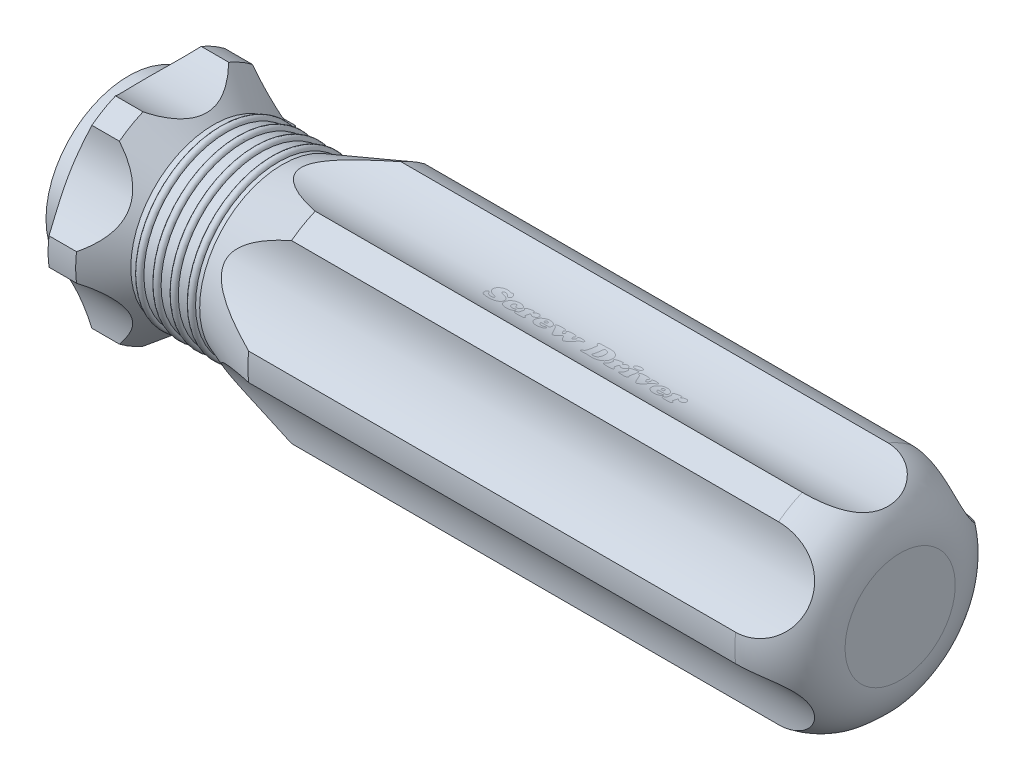
from build123d import *

# Parameters (mm, degrees)
SKETCH2_R          = 0.25
LPATTERN1_COUNT    = 4
LPATTERN1_PITCH    = 1.25
SKETCH3_R          = 6
CUT_EXTRUDE1_DEPTH = 58.131427442
CIRPATTERN1_COUNT  = 6
SKETCH5_R          = 1.5
CUT_EXTRUDE2_DEPTH = 30


with BuildPart() as part:
    # Sketch1 → Revolve1 (revolve)
    with BuildSketch(Plane.XY):
        with BuildLine():
            Line((0, 6), (1, 6))
            Line((1, 6), (2.154700538, 8))
            Line((2.154700538, 8), (4.154700538, 8))
            Line((4.154700538, 8), (6.154700538, 6))
            Line((6.154700538, 6), (11.154700538, 6))
            Line((11.154700538, 6), (16.649655377, 8))
            Line((16.649655377, 8), (52, 8))
            ThreePointArc((52, 8), (54.828427125, 6.828427125), (56, 4))
            Line((56, 4), (56, 0))
            Line((56, 0), (0, 0))
            Line((0, 0), (0, 6))
        make_face()
    revolve(axis=Axis((0, 0, 0), (1, 0, 0)))

    # Sketch2 → Revolve2 (revolve)
    with BuildSketch(Plane.XY):
        with Locations((6.854700538, 6)):
            Circle(SKETCH2_R)
    revolve2 = revolve(axis=Axis((0, 0, 0), (1, 0, 0)))

    # LPattern1: Revolve2 ×4
    with Locations(*[(i * LPATTERN1_PITCH, 0, 0) for i in range(1, LPATTERN1_COUNT)]):
        add(revolve2)

    # Sketch3 → Cut-Extrude1 (cut, through all)
    with BuildSketch(Plane.ZY):
        with Locations((0, 12.5)):
            Circle(SKETCH3_R)
    cut_extrude1 = extrude(amount=-CUT_EXTRUDE1_DEPTH, mode=Mode.SUBTRACT)

    # CirPattern1: Cut-Extrude1 ×6 about axis
    cirpattern1_axis = Axis((0, 0, 0), (-1, 0, 0))
    for i in range(1, CIRPATTERN1_COUNT):
        add(cut_extrude1.rotate(cirpattern1_axis, i * 360 / CIRPATTERN1_COUNT), mode=Mode.SUBTRACT)

    # Sketch5 → Cut-Extrude2 (cut)
    with BuildSketch(Plane.ZY):
        Circle(SKETCH5_R)
    extrude(amount=-CUT_EXTRUDE2_DEPTH, mode=Mode.SUBTRACT)


solid = part.part
